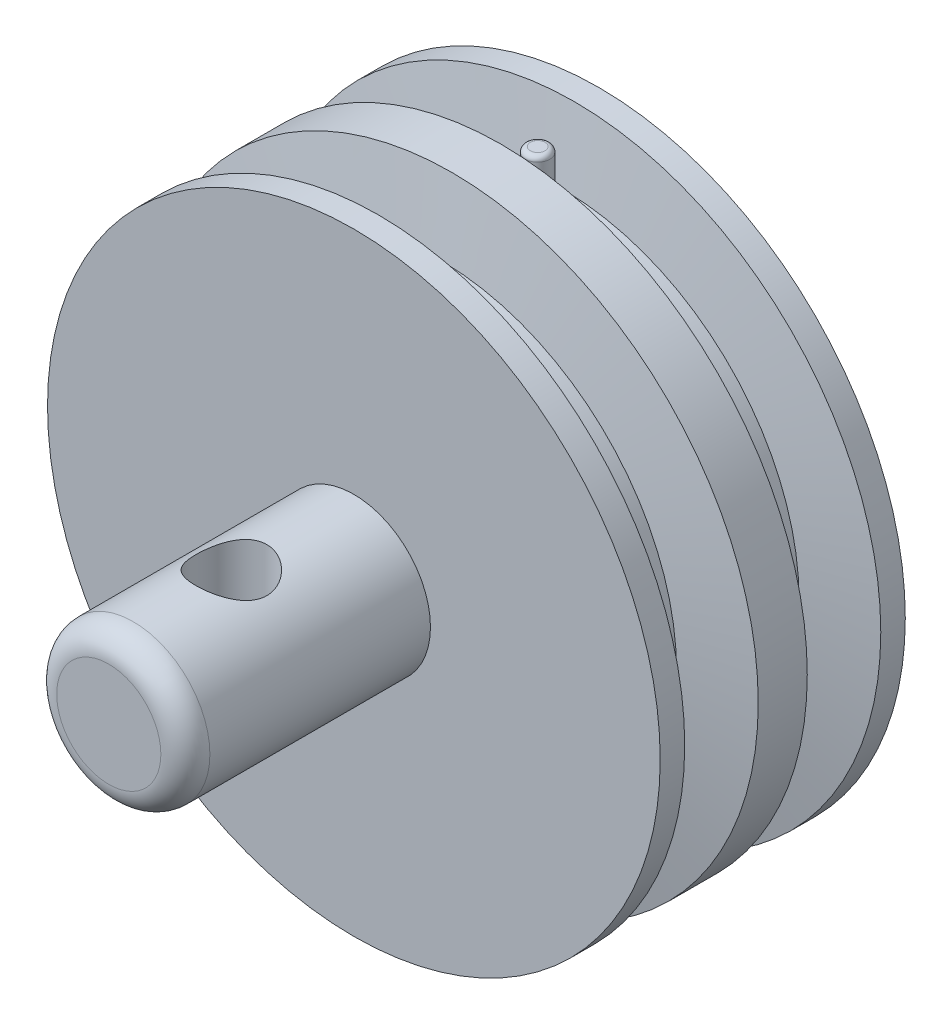
from build123d import *

# Parameters (mm, degrees)
ESQUISSE1_R                  = 3.125
BOSS_EXTRU_1_DEPTH           = 10
CONG_1_R                     = 1
ESQUISSE2_R                  = 12.5
BOSS_EXTRU_3_DEPTH           = 10
ENL_V_MAT_EXTRU_1_DEPTH      = 21.310096012
ENL_V_MAT_EXTRU_1_DEPTH_BACK = 21.310096012
ESQUISSE6_R                  = 1.45
BOSS_EXTRU_4_DEPTH           = 2
BOSS_EXTRU_4_DEPTH_BACK      = 1
ESQUISSE7_R                  = 0.5
BOSS_EXTRU_5_DEPTH           = 2
BOSS_EXTRU_5_DEPTH_BACK      = 1
ESQUISSE8_R                  = 0.5
CONG_2_R                     = 0.2


with BuildPart() as part:
    # Esquisse1 → Boss.-Extru.1 (new body)
    with BuildSketch(Plane.XY):
        Circle(ESQUISSE1_R)
    extrude(amount=BOSS_EXTRU_1_DEPTH)

    # Congé1
    cong_1_edges = [part.edges().sort_by_distance(p)[0] for p in [
        (-3.125, 0, 10),
    ]]
    fillet(cong_1_edges, radius=CONG_1_R)

    # Esquisse2 → Boss.-Extru.3 (add)
    with BuildSketch(Plane(origin=(0, 0, 0), x_dir=(-1, 0, 0), z_dir=(0, 0, -1))):
        Circle(ESQUISSE2_R)
    extrude(amount=BOSS_EXTRU_3_DEPTH)

    # Esquisse5 → Enlèvement de matière-Révolution1 (revolve, cut)
    with BuildSketch(Plane(origin=(0, 0, 0), x_dir=(0, 0, -1), z_dir=(1, 0, 0))):
        Polygon((1, 12.5), (1.5, 9.66435909), (3.5, 9.66435909), (4, 12.5), align=None)
        Polygon((6, 12.5), (9, 12.5), (8.5, 9.66435909), (6.5, 9.66435909), align=None)
    revolve(axis=Axis((0, 0, 0), (0, 0, -1)), mode=Mode.SUBTRACT)

    # Esquisse6 → Enlèv. mat.-Extru.1 (cut, two sides: drawn at the far end of the back side and taken through both)
    with BuildSketch(Plane(origin=(0, 0, 0), x_dir=(1, 0, 0), z_dir=(0, 1, 0)).offset(-ENL_V_MAT_EXTRU_1_DEPTH_BACK)):
        with Locations((0, -5)):
            Circle(ESQUISSE6_R)
    extrude(amount=ENL_V_MAT_EXTRU_1_DEPTH + ENL_V_MAT_EXTRU_1_DEPTH_BACK, mode=Mode.SUBTRACT)

    # Esquisse7 → Boss.-Extru.4 (add, two sides: drawn at the far end of the back side and taken through both)
    with BuildSketch(Plane(origin=(0, 9.66435909, 0), x_dir=(1, 0, 0), z_dir=(0, 1, 0)).offset(-BOSS_EXTRU_4_DEPTH_BACK)):
        with Locations((0, 7.5)):
            Circle(ESQUISSE7_R)
    extrude(amount=BOSS_EXTRU_4_DEPTH + BOSS_EXTRU_4_DEPTH_BACK)

    # Esquisse8 → Boss.-Extru.5 (add, two sides: drawn at the far end of the back side and taken through both)
    with BuildSketch(Plane(origin=(0, -9.66435909, 0), x_dir=(-1, 0, 0), z_dir=(0, -1, 0)).offset(-BOSS_EXTRU_5_DEPTH_BACK)):
        with Locations((0, 2.5)):
            Circle(ESQUISSE8_R)
    extrude(amount=BOSS_EXTRU_5_DEPTH + BOSS_EXTRU_5_DEPTH_BACK)

    # Congé2
    cong_2_edges = [part.edges().sort_by_distance(p)[0] for p in [
        (-0.5, 11.66435909, -7.5),
        (0.5, -11.66435909, -2.5),
    ]]
    fillet(cong_2_edges, radius=CONG_2_R)


solid = part.part
